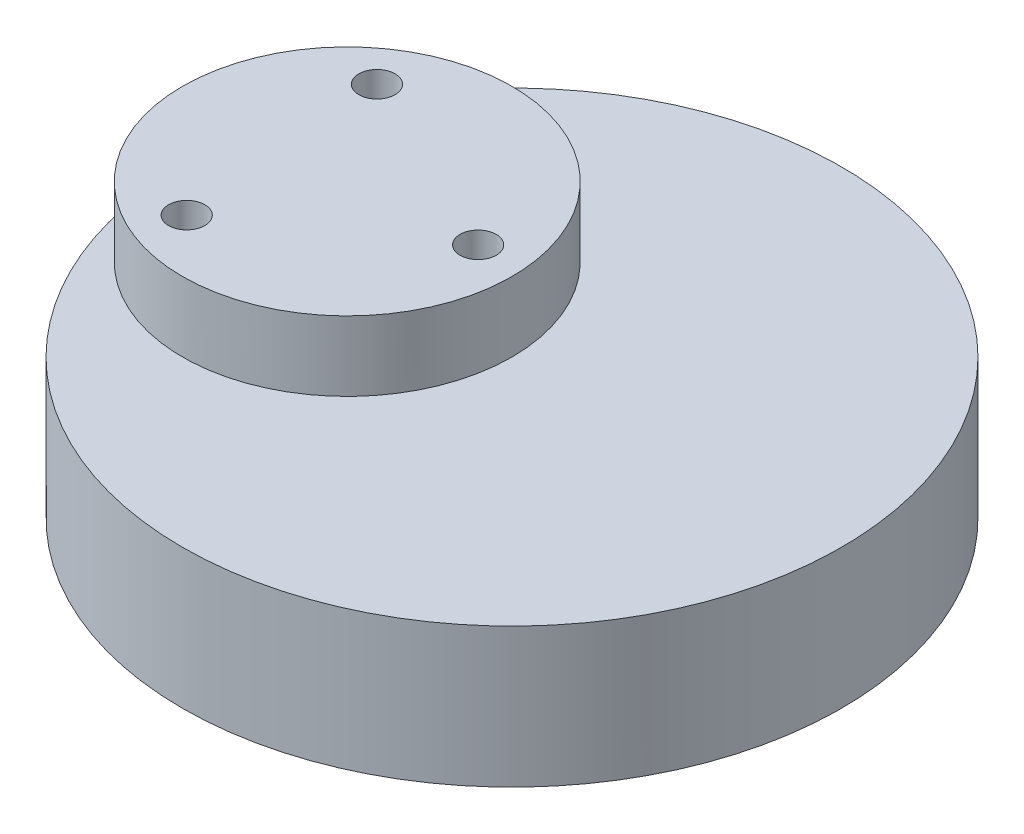
from build123d import *

# Parameters (mm, degrees)
BOSS_EXTRUDE1_DEPTH       = 6.35
SKETCH2_3_R               = 30
BOSS_EXTRUDE2_DEPTH       = 12.7
M4X0_7_TAPPED_HOLE1_D     = 3.3
M4X0_7_TAPPED_HOLE1_DEPTH = 10.1
M4X0_7_TAPPED_HOLE1_TIP   = 0.991420021
M4X0_7_TAPPED_HOLE3_D     = 3.3
M4X0_7_TAPPED_HOLE3_DEPTH = 10.1
M4X0_7_TAPPED_HOLE3_TIP   = 0.991420021


with BuildPart() as part:
    # Sketch2 → Boss-Extrude1 (new body)
    with BuildSketch(Plane(origin=(0, 0, 0), x_dir=(1, 0, 0), z_dir=(0, 1, 0))):
        with BuildLine():
            ThreePointArc((-15, 0), (0, -15), (15, 0))
            ThreePointArc((15, 0), (0, 15), (-15, 0))
        make_face()
    extrude(amount=BOSS_EXTRUDE1_DEPTH)

    # Sketch2<3> → Boss-Extrude2 (add)
    with BuildSketch(Plane(origin=(0, 0, 0), x_dir=(1, 0, 0), z_dir=(0, 1, 0))):
        with Locations((15, 0)):
            Circle(SKETCH2_3_R)
    extrude(amount=-BOSS_EXTRUDE2_DEPTH)

    # M4x0.7 Tapped Hole1
    with Locations(Plane(origin=(0, 6.35, 0), x_dir=(1, 0, 0), z_dir=(0, 1, 0))):
        with Locations((-4.648800879, -9.969385657), (10.958141679, 0.95871317), (-6.3093408, 9.010672487)):
            Hole(M4X0_7_TAPPED_HOLE1_D / 2, depth=M4X0_7_TAPPED_HOLE1_DEPTH)
            with Locations((0, 0, -(M4X0_7_TAPPED_HOLE1_DEPTH + M4X0_7_TAPPED_HOLE1_TIP / 2))):  # 118° drill point
                Cone(0, M4X0_7_TAPPED_HOLE1_D / 2, M4X0_7_TAPPED_HOLE1_TIP, mode=Mode.SUBTRACT)

    # M4x0.7 Tapped Hole3
    with Locations(Plane(origin=(0, -12.7, 0), x_dir=(-1, 0, 0), z_dir=(0, -1, 0))):
        with Locations((-15, -20), (2.320508076, 10), (-32.320508076, 10)):
            Hole(M4X0_7_TAPPED_HOLE3_D / 2, depth=M4X0_7_TAPPED_HOLE3_DEPTH)
            with Locations((0, 0, -(M4X0_7_TAPPED_HOLE3_DEPTH + M4X0_7_TAPPED_HOLE3_TIP / 2))):  # 118° drill point
                Cone(0, M4X0_7_TAPPED_HOLE3_D / 2, M4X0_7_TAPPED_HOLE3_TIP, mode=Mode.SUBTRACT)


solid = part.part
